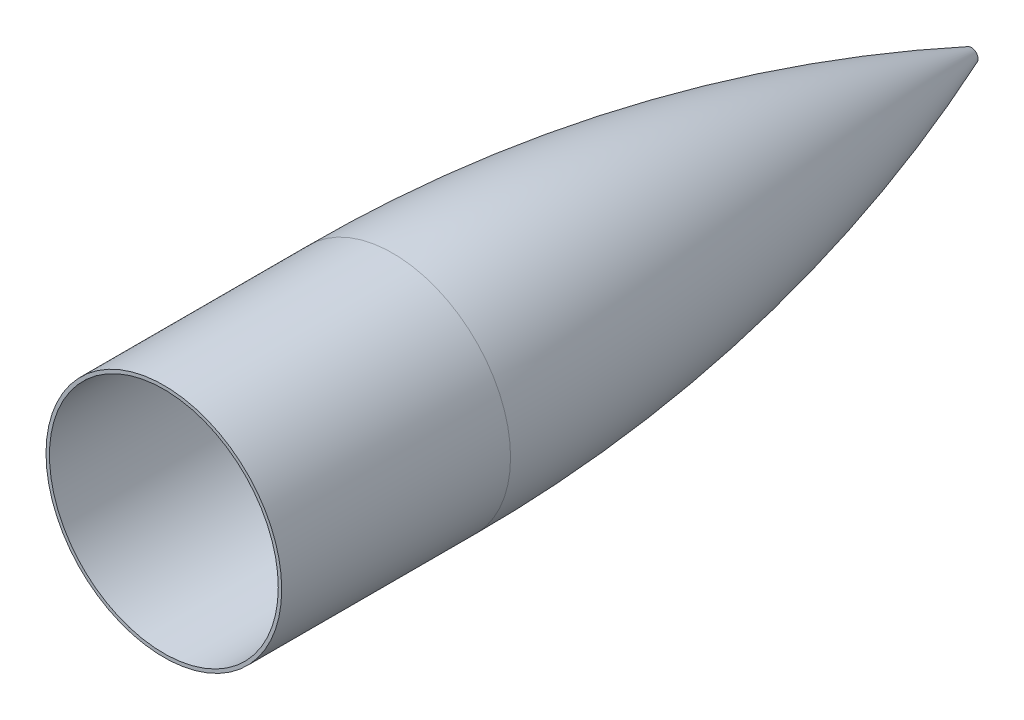
from build123d import *

# Parameters (mm, degrees)
CUT_EXTRUDE1_DEPTH  = 320.36859803
SKETCH3_R           = 3.675
CUT_EXTRUDE2_DEPTH  = 320.36859803
SKETCH8_R           = 65.405
SKETCH8_R_2         = 52.705
BOSS_EXTRUDE1_DEPTH = 127
SKETCH9_R           = 63.5
SKETCH9_R_2         = 2.5
CUT_EXTRUDE4_DEPTH  = 127


# Read off the part's stored shape, not the designer's step: Shell1
with BuildPart() as part:
    # Sketch1 → Revolve1 (revolve)
    with BuildSketch(Plane(origin=(0, 0, 0), x_dir=(1, 0, 0), z_dir=(0, 1, 0))):
        with BuildLine():
            Line((0, 431.8), (0, 101.6))
            Line((0, 101.6), (65.405, 101.6))
            ThreePointArc((65.405, 101.6), (48.896438034, 269.907645418), (0, 431.8))
        make_face()
    revolve(axis=Axis((0, 0, -431.8), (0, 0, 1)))

    # Shell1 outline → Shell1 (revolve, cut)
    with BuildSketch(Plane.XZ):
        with BuildLine():
            add(Edge.make_bspline(
                [(59.055, -101.6), (59.055, -263.749938118), (0, -414.763544811)],
                knots=[0, 0, 0, 0.372773614, 0.372773614, 0.372773614], degree=2, weights=[1, 0.982680207, 1]))
            Line((59.055, -101.6), (0, -101.5999999))
            Line((0, -101.5999999), (0, -414.763544811))
        make_face()
    revolve(axis=Axis((0, 0, 0), (0, 0, 1)), mode=Mode.SUBTRACT)

    # Sketch2 → Cut-Extrude1 (cut, through all)
    with BuildSketch(Plane.XY.offset(-407.280672059)):
        Polygon((0, 6.076611583), (-5.2625, 3.038305792), (-5.2625, -3.038305792), (0, -6.076611583), (5.2625, -3.038305792), (5.2625, 3.038305792), align=None)
    extrude(amount=CUT_EXTRUDE1_DEPTH, mode=Mode.SUBTRACT)

    # Sketch3 → Cut-Extrude2 (cut, through all)
    with BuildSketch(Plane.XY.offset(-407.280672059)):
        Circle(SKETCH3_R)
    extrude(amount=-CUT_EXTRUDE2_DEPTH, mode=Mode.SUBTRACT)

    # Sketch8 → Boss-Extrude1 (add)
    with BuildSketch(Plane.XY.offset(-101.6)):
        Circle(SKETCH8_R)
        Circle(SKETCH8_R_2, mode=Mode.SUBTRACT)
    extrude(amount=BOSS_EXTRUDE1_DEPTH)

    # Sketch9 → Cut-Extrude4 (cut)
    with BuildSketch(Plane.XY.offset(25.4)):
        Circle(SKETCH9_R)
        Circle(SKETCH9_R_2, mode=Mode.SUBTRACT)
    extrude(amount=-CUT_EXTRUDE4_DEPTH, mode=Mode.SUBTRACT)


solid = part.part
